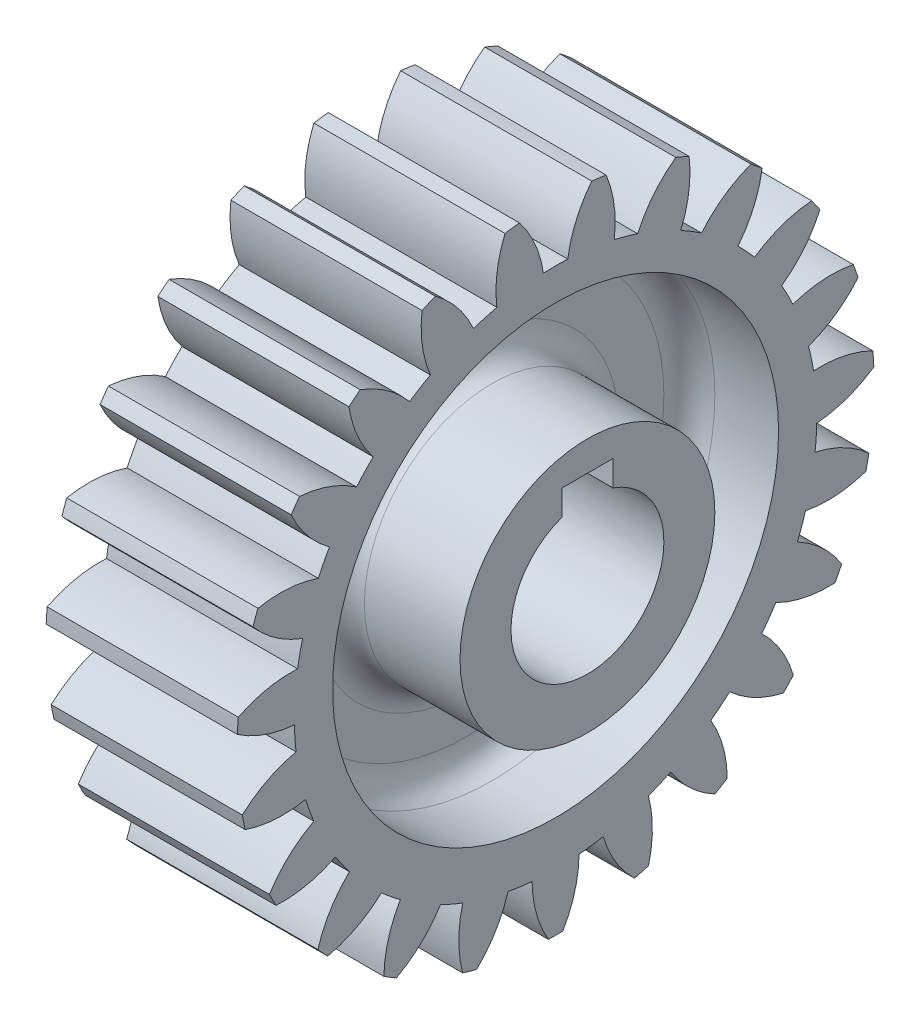
from build123d import *

# Parameters (mm, degrees)
BASPROSKE_W        = 30
BASPROSKE_H        = 50
TOOTHCUT_DEPTH     = 77.811457479
TEETHCUTS_COUNT    = 23
TEETHCUTS_ANGLE    = 344.347826087
HUBNEABOTSKE_R     = 20
HUBNEARBOTH_DEPTH  = 5.0000254
HUBFAR_START       = 5.0000254
HUBFARSKE_R        = 20
HUBFAR_DEPTH       = 5.0000254
BORSKE_R           = 12
BORE_DEPTH         = 40.0000508
KEYSKE_W           = 8
KEYSKE_H           = 15.3
KEYWAY_DEPTH       = 40.0000508
SKETCH1_R          = 35
SKETCH1_R_2        = 20
CUT_EXTRUDE1_DEPTH = 14
FILLET1_R          = 4
CUT_EXTRUDE2_START = -14
SKETCH2_R          = 35
SKETCH2_R_2        = 20
CUT_EXTRUDE2_DEPTH = 14
FILLET2_R          = 4


with BuildPart() as part:
    # BasProSke → Base-Revolve (revolve)
    with BuildSketch(Plane(origin=(0, 0, 0), x_dir=(1, 0, 0), z_dir=(0, 1, 0))):
        with Locations((15, 25)):
            Rectangle(BASPROSKE_W, BASPROSKE_H)
    revolve(axis=Axis((-10, 0, 0), (1, 0, 0)))

    # TooCutSke → ToothCut (cut, through all)
    with BuildSketch(Plane(origin=(0, 0, 0), x_dir=(0, 0, -1), z_dir=(1, 0, 0))):
        with BuildLine():
            ThreePointArc((1.90971626, 40.954498957), (0, 40.999), (-1.90971626, 40.954498957))
            ThreePointArc((-1.90971626, 40.954498957), (-3.228022445, 45.57670564), (-5.698439072, 49.699783071))
            ThreePointArc((-5.698439072, 49.699783071), (0, 50.0254), (5.698439072, 49.699783071))
            ThreePointArc((5.698439072, 49.699783071), (3.228022445, 45.57670564), (1.90971626, 40.954498957))
        make_face()
    toothcut = extrude(amount=TOOTHCUT_DEPTH, mode=Mode.SUBTRACT)

    # TeethCuts: ToothCut ×23 about axis
    teethcuts_axis = Axis((-10, 0, 0), (1, 0, 0))
    for i in range(1, TEETHCUTS_COUNT):
        add(toothcut.rotate(teethcuts_axis, i * TEETHCUTS_ANGLE / (TEETHCUTS_COUNT - 1)), mode=Mode.SUBTRACT)

    # HubNeaBotSke → HubNearBoth (add)
    with BuildSketch(Plane.ZY):
        Circle(HUBNEABOTSKE_R)
    extrude(amount=HUBNEARBOTH_DEPTH)

    # HubFarSke → HubFar (add)
    with BuildSketch(Plane(origin=(30, 0, 0), x_dir=(0, 0, -1), z_dir=(1, 0, 0)).offset(HUBFAR_START)):
        Circle(HUBFARSKE_R)
    extrude(amount=-HUBFAR_DEPTH)

    # BorSke → Bore (cut, symmetric)
    with BuildSketch(Plane(origin=(0, 0, 0), x_dir=(0, 0, -1), z_dir=(1, 0, 0))):
        Circle(BORSKE_R)
    extrude(amount=BORE_DEPTH, both=True, mode=Mode.SUBTRACT)

    # KeySke → Keyway (cut, symmetric)
    with BuildSketch(Plane(origin=(0, 0, 0), x_dir=(0, 0, -1), z_dir=(1, 0, 0))):
        with Locations((0, 7.65)):
            Rectangle(KEYSKE_W, KEYSKE_H)
    extrude(amount=KEYWAY_DEPTH, both=True, mode=Mode.SUBTRACT)

    # Sketch1 → Cut-Extrude1 (cut)
    with BuildSketch(Plane(origin=(30, 0, 0), x_dir=(0, 0, -1), z_dir=(1, 0, 0))):
        with Locations((0, 0.98088297)):
            Circle(SKETCH1_R)
        Circle(SKETCH1_R_2, mode=Mode.SUBTRACT)
    extrude(amount=-CUT_EXTRUDE1_DEPTH, mode=Mode.SUBTRACT)

    # Fillet1
    fillet1_edges = [part.edges().sort_by_distance(p)[0] for p in [
        (16, 0, 20),
        (16, 0.98088297, 35),
    ]]
    fillet(fillet1_edges, radius=FILLET1_R)

    # Sketch2 → Cut-Extrude2 (cut)
    with BuildSketch(Plane.ZY.offset(CUT_EXTRUDE2_START)):
        Circle(SKETCH2_R)
        Circle(SKETCH2_R_2, mode=Mode.SUBTRACT)
    extrude(amount=CUT_EXTRUDE2_DEPTH, mode=Mode.SUBTRACT)

    # Fillet2
    fillet2_edges = [part.edges().sort_by_distance(p)[0] for p in [
        (14, 0, -20),
        (14, 0, -35),
    ]]
    fillet(fillet2_edges, radius=FILLET2_R)


solid = part.part
